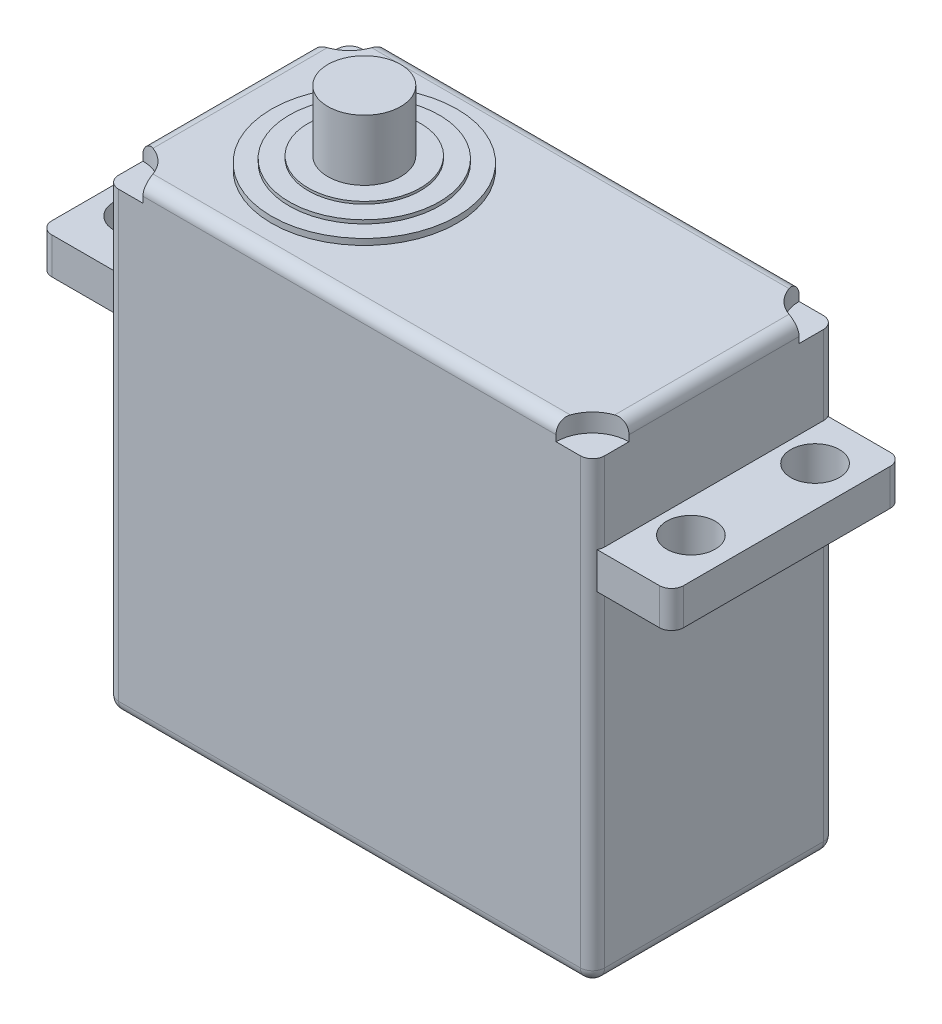
from build123d import *

# Parameters (mm, degrees)
SKETCH_1_W           = 40
SKETCH_1_H           = 39
EXTRUDE_1_DEPTH      = 20
SHELL_1_T            = 2
SKETCH_18_R          = 7.639183899
EXTRUDE_8_DEPTH      = 0.5
SKETCH_24_R          = 6.182414347
EXTRUDE_12_DEPTH     = 0.3
SKETCH_25_R          = 4.612744259
EXTRUDE_13_DEPTH     = 0.2
SKETCH_52_R          = 3
EXTRUDE_14_DEPTH     = 5
SKETCH_55_R          = 3
CUT_EXTRUDE_37_DEPTH = 1.5
SKETCH_78_W          = 19
SKETCH_78_H          = 3
EXTRUDE_16_DEPTH     = 6
SKETCH_79_W          = 19
SKETCH_79_H          = 3
EXTRUDE_17_DEPTH     = 6
FILLET_7_R           = 1
SKETCH_5_R           = 2
CUT_EXTRUDE_45_DEPTH = 50
FILLET_8_R           = 1


with BuildPart() as part:
    # 草图1 → 凸台-拉伸1 (new body)
    with BuildSketch(Plane.XY):
        with Locations((-20, 19.5)):
            Rectangle(SKETCH_1_W, SKETCH_1_H)
    extrude(amount=EXTRUDE_1_DEPTH)

    # 抽壳1 (no face opened: a closed hollow body)
    add(offset(amount=-SHELL_1_T, mode=Mode.PRIVATE), mode=Mode.SUBTRACT)

    # 草图18 → 凸台-拉伸8 (add)
    with BuildSketch(Plane(origin=(0, 39, 0), x_dir=(1, 0, 0), z_dir=(0, 1, 0))):
        with Locations((-28.781890175, -10)):
            Circle(SKETCH_18_R)
    extrude(amount=EXTRUDE_8_DEPTH)

    # 草图24 → 凸台-拉伸12 (add)
    with BuildSketch(Plane(origin=(0, 39.5, 0), x_dir=(1, 0, 0), z_dir=(0, 1, 0))):
        with Locations(Location((-28.781890175, -10, 0), (0, 0, 180))):
            Circle(SKETCH_24_R)
    extrude(amount=EXTRUDE_12_DEPTH)

    # 草图25 → 凸台-拉伸13 (add)
    with BuildSketch(Plane(origin=(0, 39.8, 0), x_dir=(1, 0, 0), z_dir=(0, 1, 0))):
        with Locations(Location((-28.781890175, -10, 0), (0, 0, 180))):
            Circle(SKETCH_25_R)
    extrude(amount=EXTRUDE_13_DEPTH)

    # 草图52 → 凸台-拉伸14 (add)
    with BuildSketch(Plane(origin=(0, 40, 0), x_dir=(1, 0, 0), z_dir=(0, 1, 0))):
        with Locations(Location((-28.781890175, -10, 0), (0, 0, 180))):
            Circle(SKETCH_52_R)
    extrude(amount=EXTRUDE_14_DEPTH)

    # 草图55 → 切除-拉伸37 (cut)
    with BuildSketch(Plane(origin=(0, 39, 0), x_dir=(1, 0, 0), z_dir=(0, 1, 0))):
        with Locations((-40, -20)):
            Circle(SKETCH_55_R)
        with Locations((-40, 0)):
            Circle(SKETCH_55_R)
        with Locations((0, -20)):
            Circle(SKETCH_55_R)
        Circle(SKETCH_55_R)
    extrude(amount=-CUT_EXTRUDE_37_DEPTH, mode=Mode.SUBTRACT)

    # 草图78 → 凸台-拉伸16 (add)
    with BuildSketch(Plane(origin=(0, 0, 0), x_dir=(0, 0, -1), z_dir=(1, 0, 0))):
        with Locations((-10, 29.5)):
            Rectangle(SKETCH_78_W, SKETCH_78_H)
    extrude(amount=EXTRUDE_16_DEPTH)

    # 草图79 → 凸台-拉伸17 (add)
    with BuildSketch(Plane.ZY.offset(40)):
        with Locations((10, 29.5)):
            Rectangle(SKETCH_79_W, SKETCH_79_H)
    extrude(amount=EXTRUDE_17_DEPTH)

    # 圆角7
    # the kernel refuses this fillet: 1 mm, written as the material it takes off along each edge
    with BuildSketch(Plane(origin=(-46, 33.5, 19.5), x_dir=(1, 0, 0), z_dir=(0, -1, 0))) as fillet_7_piece_1:
        with BuildLine():
            CenterArc((FILLET_7_R, -FILLET_7_R), FILLET_7_R, 90, 90)
            Line((0, -FILLET_7_R), (0, 0))
            Line((0, 0), (FILLET_7_R, 0))
        make_face()
    extrude(amount=8, mode=Mode.SUBTRACT)
    with BuildSketch(Plane(origin=(-40, -2.5, 20), x_dir=(1, 0, 0), z_dir=(0, 1, 0))) as fillet_7_piece_2_section:
        with BuildLine():
            CenterArc((FILLET_7_R, FILLET_7_R), FILLET_7_R, 180, 90)
            Line((0, FILLET_7_R), (0, 0))
            Line((0, 0), (FILLET_7_R, 0))
        make_face()
    fillet_7_piece_2 = extrude(amount=42.5, mode=Mode.PRIVATE)
    fillet_7_piece_2 = split(fillet_7_piece_2, bisect_by=Plane(origin=(-39.74487994, 28, 19.835608236), z_dir=(0, -1, 0)), keep=Keep.TOP, mode=Mode.PRIVATE)
    fillet_7_piece_2 = split(fillet_7_piece_2, bisect_by=Plane(origin=(-39.74487994, 12.75, 19.5), z_dir=(0, 0, 1)), keep=Keep.TOP, mode=Mode.PRIVATE)
    add(fillet_7_piece_2, mode=Mode.SUBTRACT)
    with BuildSketch(Plane(origin=(-40, -2.5, 20), x_dir=(1, 0, 0), z_dir=(0, 1, 0))) as fillet_7_piece_3_section:
        with BuildLine():
            CenterArc((FILLET_7_R, FILLET_7_R), FILLET_7_R, 180, 90)
            Line((0, FILLET_7_R), (0, 0))
            Line((0, 0), (FILLET_7_R, 0))
        make_face()
    fillet_7_piece_3 = extrude(amount=42.5, mode=Mode.PRIVATE)
    fillet_7_piece_3 = split(fillet_7_piece_3, bisect_by=Plane(origin=(-39.975991618, 28, 19.336749215), z_dir=(0, -1, 0)), keep=Keep.TOP, mode=Mode.PRIVATE)
    fillet_7_piece_3 = split(fillet_7_piece_3, bisect_by=Plane(origin=(-39.975991618, 12.75, 19.5), z_dir=(0, 0, -1)), keep=Keep.TOP, mode=Mode.PRIVATE)
    add(fillet_7_piece_3, mode=Mode.SUBTRACT)
    with BuildSketch(Plane(origin=(-40, -2.5, 20), x_dir=(1, 0, 0), z_dir=(0, 1, 0))) as fillet_7_piece_4_section:
        with BuildLine():
            CenterArc((FILLET_7_R, FILLET_7_R), FILLET_7_R, 180, 90)
            Line((0, FILLET_7_R), (0, 0))
            Line((0, 0), (FILLET_7_R, 0))
        make_face()
    fillet_7_piece_4 = extrude(amount=42.5, mode=Mode.PRIVATE)
    fillet_7_piece_4 = split(fillet_7_piece_4, bisect_by=Plane(origin=(-39.74487994, 28, 19.835608236), z_dir=(0, 1, 0)), keep=Keep.TOP, mode=Mode.PRIVATE)
    fillet_7_piece_4 = split(fillet_7_piece_4, bisect_by=Plane(origin=(-39.74487994, 29.5, 19.5), z_dir=(0, 0, 1)), keep=Keep.TOP, mode=Mode.PRIVATE)
    fillet_7_piece_4 = split(fillet_7_piece_4, bisect_by=Plane(origin=(-39.74487994, 31, 19.835608236), z_dir=(0, -1, 0)), keep=Keep.TOP, mode=Mode.PRIVATE)
    add(fillet_7_piece_4, mode=Mode.SUBTRACT)
    with BuildSketch(Plane(origin=(-40, -2.5, 20), x_dir=(1, 0, 0), z_dir=(0, 1, 0))) as fillet_7_piece_5_section:
        with BuildLine():
            CenterArc((FILLET_7_R, FILLET_7_R), FILLET_7_R, 180, 90)
            Line((0, FILLET_7_R), (0, 0))
            Line((0, 0), (FILLET_7_R, 0))
        make_face()
    fillet_7_piece_5 = extrude(amount=42.5, mode=Mode.PRIVATE)
    fillet_7_piece_5 = split(fillet_7_piece_5, bisect_by=Plane(origin=(-39.74487994, 35.5, 19.5), z_dir=(0, 0, 1)), keep=Keep.TOP, mode=Mode.PRIVATE)
    fillet_7_piece_5 = split(fillet_7_piece_5, bisect_by=Plane(origin=(-39.74487994, 31, 19.835608236), z_dir=(0, 1, 0)), keep=Keep.TOP, mode=Mode.PRIVATE)
    add(fillet_7_piece_5, mode=Mode.SUBTRACT)
    with BuildSketch(Plane(origin=(-40, -2.5, 20), x_dir=(1, 0, 0), z_dir=(0, 1, 0))) as fillet_7_piece_6_section:
        with BuildLine():
            CenterArc((FILLET_7_R, FILLET_7_R), FILLET_7_R, 180, 90)
            Line((0, FILLET_7_R), (0, 0))
            Line((0, 0), (FILLET_7_R, 0))
        make_face()
    fillet_7_piece_6 = extrude(amount=42.5, mode=Mode.PRIVATE)
    fillet_7_piece_6 = split(fillet_7_piece_6, bisect_by=Plane(origin=(-39.975991618, 35.5, 19.5), z_dir=(0, 0, -1)), keep=Keep.TOP, mode=Mode.PRIVATE)
    fillet_7_piece_6 = split(fillet_7_piece_6, bisect_by=Plane(origin=(-39.975991618, 31, 19.336749215), z_dir=(0, 1, 0)), keep=Keep.TOP, mode=Mode.PRIVATE)
    add(fillet_7_piece_6, mode=Mode.SUBTRACT)

    # 草图5 → 切除-拉伸45 (cut)
    with BuildSketch(Plane(origin=(0, 0, 0), x_dir=(1, 0, 0), z_dir=(0, 1, 0))):
        with Locations(Location((-42.781890175, -14.609647665, 0), (0, 0, 90))):
            Circle(SKETCH_5_R)
        with Locations(Location((-42.853081645, -4.609647665, 0), (0, 0, 90))):
            Circle(SKETCH_5_R)
        with Locations((2.709458981, -4.393671759)):
            Circle(SKETCH_5_R)
        with Locations((2.709458981, -14.609647665)):
            Circle(SKETCH_5_R)
    extrude(amount=CUT_EXTRUDE_45_DEPTH, mode=Mode.SUBTRACT)

    # 圆角8
    # the kernel refuses this fillet: 1 mm, written as the material it takes off along each edge
    with BuildSketch(Plane(origin=(-1, 1, 19), x_dir=(1, 0, 0), z_dir=(0, -1, 0))) as fillet_8_piece_1_section:
        Polygon((0, 0), (FILLET_8_R, 0), (FILLET_8_R, FILLET_8_R), (0, FILLET_8_R), align=None)
    fillet_8_piece_1 = extrude(amount=FILLET_8_R, mode=Mode.PRIVATE)
    fillet_8_piece_1 = fillet_8_piece_1 - Plane(origin=(-1, 1, 19), x_dir=(-0.7071067811865475, 0, -0.7071067811865475), z_dir=(0, -1, 0)) * Sphere(FILLET_8_R, mode=Mode.PRIVATE)
    add(fillet_8_piece_1, mode=Mode.SUBTRACT)
    with BuildSketch(Plane(origin=(-39, 1, 1), x_dir=(0, 0, -1), z_dir=(-1, 0, 0))) as fillet_8_piece_2_section:
        Polygon((0, 0), (FILLET_8_R, 0), (FILLET_8_R, FILLET_8_R), (0, FILLET_8_R), align=None)
    fillet_8_piece_2 = extrude(amount=FILLET_8_R, mode=Mode.PRIVATE)
    fillet_8_piece_2 = fillet_8_piece_2 - Plane(origin=(-39, 1, 1), x_dir=(0, 0.7071067811865475, 0.7071067811865475), z_dir=(-1, 0, 0)) * Sphere(FILLET_8_R, mode=Mode.PRIVATE)
    add(fillet_8_piece_2, mode=Mode.SUBTRACT)
    with BuildSketch(Plane(origin=(-1, 1, 1), x_dir=(0, -1, 0), z_dir=(0, 0, -1))) as fillet_8_piece_3_section:
        Polygon((0, 0), (FILLET_8_R, 0), (FILLET_8_R, -FILLET_8_R), (0, -FILLET_8_R), align=None)
    fillet_8_piece_3 = extrude(amount=FILLET_8_R, mode=Mode.PRIVATE)
    fillet_8_piece_3 = fillet_8_piece_3 - Plane(origin=(-1, 1, 1), x_dir=(-0.7071067811865475, 0.7071067811865475, 0), z_dir=(0, 0, -1)) * Sphere(FILLET_8_R, mode=Mode.PRIVATE)
    add(fillet_8_piece_3, mode=Mode.SUBTRACT)
    with BuildSketch(Plane(origin=(-1, 0, 20), x_dir=(0, 1, 0), z_dir=(-1, 0, 0))) as fillet_8_piece_4:
        with BuildLine():
            CenterArc((FILLET_8_R, FILLET_8_R), FILLET_8_R, 180, 90)
            Line((0, FILLET_8_R), (0, 0))
            Line((0, 0), (FILLET_8_R, 0))
        make_face()
    extrude(amount=38, mode=Mode.SUBTRACT)
    with BuildSketch(Plane(origin=(-39, 0, 19), x_dir=(0, 0, 1), z_dir=(1, 0, 0))) as fillet_8_piece_5:
        with BuildLine():
            CenterArc((1 - FILLET_8_R, -FILLET_8_R), FILLET_8_R, 0, 90)
            Line((1, -FILLET_8_R), (1, 0))
            Line((1, 0), (1 - FILLET_8_R, 0))
        make_face()
    revolve(axis=Axis((-39, 0, 19), (0, -1, 0)), revolution_arc=90, mode=Mode.SUBTRACT)
    with BuildSketch(Plane(origin=(-40, 0, 1), x_dir=(0, 1, 0), z_dir=(0, 0, 1))) as fillet_8_piece_6:
        with BuildLine():
            CenterArc((FILLET_8_R, -FILLET_8_R), FILLET_8_R, 90, 90)
            Line((0, -FILLET_8_R), (0, 0))
            Line((0, 0), (FILLET_8_R, 0))
        make_face()
    extrude(amount=18, mode=Mode.SUBTRACT)
    with BuildSketch(Plane(origin=(0, 0, 1), x_dir=(0, 1, 0), z_dir=(0, 0, 1))) as fillet_8_piece_7:
        with BuildLine():
            CenterArc((FILLET_8_R, FILLET_8_R), FILLET_8_R, 180, 90)
            Line((0, FILLET_8_R), (0, 0))
            Line((0, 0), (FILLET_8_R, 0))
        make_face()
    extrude(amount=18, mode=Mode.SUBTRACT)
    with BuildSketch(Plane(origin=(-1, 0, 0), x_dir=(0, 1, 0), z_dir=(-1, 0, 0))) as fillet_8_piece_8:
        with BuildLine():
            CenterArc((FILLET_8_R, -FILLET_8_R), FILLET_8_R, 90, 90)
            Line((0, -FILLET_8_R), (0, 0))
            Line((0, 0), (FILLET_8_R, 0))
        make_face()
    extrude(amount=38, mode=Mode.SUBTRACT)
    with BuildSketch(Plane(origin=(0, 40, 0), x_dir=(-1, 0, 0), z_dir=(0, -1, 0))) as fillet_8_piece_9_section:
        with BuildLine():
            CenterArc((FILLET_8_R, -FILLET_8_R), FILLET_8_R, 90, 90)
            Line((0, -FILLET_8_R), (0, 0))
            Line((0, 0), (FILLET_8_R, 0))
        make_face()
    fillet_8_piece_9 = extrude(amount=39, mode=Mode.PRIVATE)
    fillet_8_piece_9 = split(fillet_8_piece_9, bisect_by=Plane(origin=(-0.25512006, 35.5, 0.5), z_dir=(0, 0, -1)), keep=Keep.TOP, mode=Mode.PRIVATE)
    fillet_8_piece_9 = split(fillet_8_piece_9, bisect_by=Plane(origin=(-0.25512006, 31, 0.164391764), z_dir=(0, 1, 0)), keep=Keep.TOP, mode=Mode.PRIVATE)
    add(fillet_8_piece_9, mode=Mode.SUBTRACT)
    with BuildSketch(Plane(origin=(0, 40, 0), x_dir=(-1, 0, 0), z_dir=(0, -1, 0))) as fillet_8_piece_10_section:
        with BuildLine():
            CenterArc((FILLET_8_R, -FILLET_8_R), FILLET_8_R, 90, 90)
            Line((0, -FILLET_8_R), (0, 0))
            Line((0, 0), (FILLET_8_R, 0))
        make_face()
    fillet_8_piece_10 = extrude(amount=39, mode=Mode.PRIVATE)
    fillet_8_piece_10 = split(fillet_8_piece_10, bisect_by=Plane(origin=(-0.024008382, 35.5, 0.5), z_dir=(0, 0, 1)), keep=Keep.TOP, mode=Mode.PRIVATE)
    fillet_8_piece_10 = split(fillet_8_piece_10, bisect_by=Plane(origin=(-0.024008382, 31, 0.663250785), z_dir=(0, 1, 0)), keep=Keep.TOP, mode=Mode.PRIVATE)
    add(fillet_8_piece_10, mode=Mode.SUBTRACT)
    with BuildSketch(Plane(origin=(0, 40, 0), x_dir=(-1, 0, 0), z_dir=(0, -1, 0))) as fillet_8_piece_11_section:
        with BuildLine():
            CenterArc((FILLET_8_R, -FILLET_8_R), FILLET_8_R, 90, 90)
            Line((0, -FILLET_8_R), (0, 0))
            Line((0, 0), (FILLET_8_R, 0))
        make_face()
    fillet_8_piece_11 = extrude(amount=39, mode=Mode.PRIVATE)
    fillet_8_piece_11 = split(fillet_8_piece_11, bisect_by=Plane(origin=(-0.25512006, 28, 0.164391764), z_dir=(0, 1, 0)), keep=Keep.TOP, mode=Mode.PRIVATE)
    fillet_8_piece_11 = split(fillet_8_piece_11, bisect_by=Plane(origin=(-0.25512006, 29.5, 0.5), z_dir=(0, 0, -1)), keep=Keep.TOP, mode=Mode.PRIVATE)
    fillet_8_piece_11 = split(fillet_8_piece_11, bisect_by=Plane(origin=(-0.25512006, 31, 0.164391764), z_dir=(0, -1, 0)), keep=Keep.TOP, mode=Mode.PRIVATE)
    add(fillet_8_piece_11, mode=Mode.SUBTRACT)
    with BuildSketch(Plane(origin=(0, 40, 0), x_dir=(-1, 0, 0), z_dir=(0, -1, 0))) as fillet_8_piece_12_section:
        with BuildLine():
            CenterArc((FILLET_8_R, -FILLET_8_R), FILLET_8_R, 90, 90)
            Line((0, -FILLET_8_R), (0, 0))
            Line((0, 0), (FILLET_8_R, 0))
        make_face()
    fillet_8_piece_12 = extrude(amount=39, mode=Mode.PRIVATE)
    fillet_8_piece_12 = split(fillet_8_piece_12, bisect_by=Plane(origin=(-0.25512006, 28, 0.164391764), z_dir=(0, -1, 0)), keep=Keep.TOP, mode=Mode.PRIVATE)
    fillet_8_piece_12 = split(fillet_8_piece_12, bisect_by=Plane(origin=(-0.25512006, 14.5, 0.5), z_dir=(0, 0, -1)), keep=Keep.TOP, mode=Mode.PRIVATE)
    add(fillet_8_piece_12, mode=Mode.SUBTRACT)
    with BuildSketch(Plane(origin=(0, 40, 0), x_dir=(-1, 0, 0), z_dir=(0, -1, 0))) as fillet_8_piece_13_section:
        with BuildLine():
            CenterArc((FILLET_8_R, -FILLET_8_R), FILLET_8_R, 90, 90)
            Line((0, -FILLET_8_R), (0, 0))
            Line((0, 0), (FILLET_8_R, 0))
        make_face()
    fillet_8_piece_13 = extrude(amount=39, mode=Mode.PRIVATE)
    fillet_8_piece_13 = split(fillet_8_piece_13, bisect_by=Plane(origin=(-0.024008382, 28, 0.663250785), z_dir=(0, -1, 0)), keep=Keep.TOP, mode=Mode.PRIVATE)
    fillet_8_piece_13 = split(fillet_8_piece_13, bisect_by=Plane(origin=(-0.024008382, 14.5, 0.5), z_dir=(0, 0, 1)), keep=Keep.TOP, mode=Mode.PRIVATE)
    add(fillet_8_piece_13, mode=Mode.SUBTRACT)
    with BuildSketch(Plane(origin=(-40, 1, 0), x_dir=(1, 0, 0), z_dir=(0, 1, 0))) as fillet_8_piece_14_section:
        with BuildLine():
            CenterArc((FILLET_8_R, -FILLET_8_R), FILLET_8_R, 90, 90)
            Line((0, -FILLET_8_R), (0, 0))
            Line((0, 0), (FILLET_8_R, 0))
        make_face()
    fillet_8_piece_14 = extrude(amount=39, mode=Mode.PRIVATE)
    fillet_8_piece_14 = split(fillet_8_piece_14, bisect_by=Plane(origin=(-39.74487994, 14.5, 0.5), z_dir=(0, 0, -1)), keep=Keep.TOP, mode=Mode.PRIVATE)
    fillet_8_piece_14 = split(fillet_8_piece_14, bisect_by=Plane(origin=(-39.74487994, 28, 0.164391764), z_dir=(0, -1, 0)), keep=Keep.TOP, mode=Mode.PRIVATE)
    add(fillet_8_piece_14, mode=Mode.SUBTRACT)
    with BuildSketch(Plane(origin=(-40, 1, 0), x_dir=(1, 0, 0), z_dir=(0, 1, 0))) as fillet_8_piece_15_section:
        with BuildLine():
            CenterArc((FILLET_8_R, -FILLET_8_R), FILLET_8_R, 90, 90)
            Line((0, -FILLET_8_R), (0, 0))
            Line((0, 0), (FILLET_8_R, 0))
        make_face()
    fillet_8_piece_15 = extrude(amount=39, mode=Mode.PRIVATE)
    fillet_8_piece_15 = split(fillet_8_piece_15, bisect_by=Plane(origin=(-39.975991618, 14.5, 0.5), z_dir=(0, 0, 1)), keep=Keep.TOP, mode=Mode.PRIVATE)
    fillet_8_piece_15 = split(fillet_8_piece_15, bisect_by=Plane(origin=(-39.975991618, 28, 0.663250785), z_dir=(0, -1, 0)), keep=Keep.TOP, mode=Mode.PRIVATE)
    add(fillet_8_piece_15, mode=Mode.SUBTRACT)
    with BuildSketch(Plane(origin=(-40, 1, 0), x_dir=(1, 0, 0), z_dir=(0, 1, 0))) as fillet_8_piece_16_section:
        with BuildLine():
            CenterArc((FILLET_8_R, -FILLET_8_R), FILLET_8_R, 90, 90)
            Line((0, -FILLET_8_R), (0, 0))
            Line((0, 0), (FILLET_8_R, 0))
        make_face()
    fillet_8_piece_16 = extrude(amount=39, mode=Mode.PRIVATE)
    fillet_8_piece_16 = split(fillet_8_piece_16, bisect_by=Plane(origin=(-39.74487994, 31, 0.164391764), z_dir=(0, -1, 0)), keep=Keep.TOP, mode=Mode.PRIVATE)
    fillet_8_piece_16 = split(fillet_8_piece_16, bisect_by=Plane(origin=(-39.74487994, 29.5, 0.5), z_dir=(0, 0, -1)), keep=Keep.TOP, mode=Mode.PRIVATE)
    fillet_8_piece_16 = split(fillet_8_piece_16, bisect_by=Plane(origin=(-39.74487994, 28, 0.164391764), z_dir=(0, 1, 0)), keep=Keep.TOP, mode=Mode.PRIVATE)
    add(fillet_8_piece_16, mode=Mode.SUBTRACT)
    with BuildSketch(Plane(origin=(-40, 1, 0), x_dir=(1, 0, 0), z_dir=(0, 1, 0))) as fillet_8_piece_17_section:
        with BuildLine():
            CenterArc((FILLET_8_R, -FILLET_8_R), FILLET_8_R, 90, 90)
            Line((0, -FILLET_8_R), (0, 0))
            Line((0, 0), (FILLET_8_R, 0))
        make_face()
    fillet_8_piece_17 = extrude(amount=39, mode=Mode.PRIVATE)
    fillet_8_piece_17 = split(fillet_8_piece_17, bisect_by=Plane(origin=(-39.74487994, 31, 0.164391764), z_dir=(0, 1, 0)), keep=Keep.TOP, mode=Mode.PRIVATE)
    fillet_8_piece_17 = split(fillet_8_piece_17, bisect_by=Plane(origin=(-39.74487994, 35.5, 0.5), z_dir=(0, 0, -1)), keep=Keep.TOP, mode=Mode.PRIVATE)
    add(fillet_8_piece_17, mode=Mode.SUBTRACT)
    with BuildSketch(Plane(origin=(-40, 1, 0), x_dir=(1, 0, 0), z_dir=(0, 1, 0))) as fillet_8_piece_18_section:
        with BuildLine():
            CenterArc((FILLET_8_R, -FILLET_8_R), FILLET_8_R, 90, 90)
            Line((0, -FILLET_8_R), (0, 0))
            Line((0, 0), (FILLET_8_R, 0))
        make_face()
    fillet_8_piece_18 = extrude(amount=39, mode=Mode.PRIVATE)
    fillet_8_piece_18 = split(fillet_8_piece_18, bisect_by=Plane(origin=(-39.975991618, 31, 0.663250785), z_dir=(0, 1, 0)), keep=Keep.TOP, mode=Mode.PRIVATE)
    fillet_8_piece_18 = split(fillet_8_piece_18, bisect_by=Plane(origin=(-39.975991618, 35.5, 0.5), z_dir=(0, 0, 1)), keep=Keep.TOP, mode=Mode.PRIVATE)
    add(fillet_8_piece_18, mode=Mode.SUBTRACT)
    with BuildSketch(Plane(origin=(-46, 25.5, 0.5), x_dir=(1, 0, 0), z_dir=(0, 1, 0)), Plane(origin=(6, 25.5, 19.5), x_dir=(-1, 0, 0), z_dir=(0, 1, 0)), Plane(origin=(6, 33.5, 0.5), x_dir=(-1, 0, 0), z_dir=(0, -1, 0))) as fillet_8_piece_19:
        with BuildLine():
            CenterArc((FILLET_8_R, -FILLET_8_R), FILLET_8_R, 90, 90)
            Line((0, -FILLET_8_R), (0, 0))
            Line((0, 0), (FILLET_8_R, 0))
        make_face()
    extrude(amount=8, mode=Mode.SUBTRACT)
    with BuildSketch(Plane(origin=(-39.5, 39, 0), x_dir=(0, 0, 1), z_dir=(1, 0, 0))) as fillet_8_piece_20:
        with BuildLine():
            CenterArc((FILLET_8_R, FILLET_8_R), FILLET_8_R, 180, 90)
            Line((0, FILLET_8_R), (0, 0))
            Line((0, 0), (FILLET_8_R, 0))
        make_face()
    extrude(amount=39, mode=Mode.SUBTRACT)
    with BuildSketch(Plane(origin=(0, 39, 0.5), x_dir=(-1, 0, 0), z_dir=(0, 0, 1))) as fillet_8_piece_21:
        with BuildLine():
            CenterArc((FILLET_8_R, FILLET_8_R), FILLET_8_R, 180, 90)
            Line((0, FILLET_8_R), (0, 0))
            Line((0, 0), (FILLET_8_R, 0))
        make_face()
    extrude(amount=19, mode=Mode.SUBTRACT)
    with BuildSketch(Plane(origin=(0, 40, 20), x_dir=(0, 0, -1), z_dir=(0, -1, 0))) as fillet_8_piece_22_section:
        with BuildLine():
            CenterArc((FILLET_8_R, -FILLET_8_R), FILLET_8_R, 90, 90)
            Line((0, -FILLET_8_R), (0, 0))
            Line((0, 0), (FILLET_8_R, 0))
        make_face()
    fillet_8_piece_22 = extrude(amount=39, mode=Mode.PRIVATE)
    fillet_8_piece_22 = split(fillet_8_piece_22, bisect_by=Plane(origin=(-0.024008382, 35.5, 19.5), z_dir=(0, 0, -1)), keep=Keep.TOP, mode=Mode.PRIVATE)
    fillet_8_piece_22 = split(fillet_8_piece_22, bisect_by=Plane(origin=(-0.024008382, 31, 19.336749215), z_dir=(0, 1, 0)), keep=Keep.TOP, mode=Mode.PRIVATE)
    add(fillet_8_piece_22, mode=Mode.SUBTRACT)
    with BuildSketch(Plane(origin=(0, 40, 20), x_dir=(0, 0, -1), z_dir=(0, -1, 0))) as fillet_8_piece_23_section:
        with BuildLine():
            CenterArc((FILLET_8_R, -FILLET_8_R), FILLET_8_R, 90, 90)
            Line((0, -FILLET_8_R), (0, 0))
            Line((0, 0), (FILLET_8_R, 0))
        make_face()
    fillet_8_piece_23 = extrude(amount=39, mode=Mode.PRIVATE)
    fillet_8_piece_23 = split(fillet_8_piece_23, bisect_by=Plane(origin=(-0.25512006, 35.5, 19.5), z_dir=(0, 0, 1)), keep=Keep.TOP, mode=Mode.PRIVATE)
    fillet_8_piece_23 = split(fillet_8_piece_23, bisect_by=Plane(origin=(-0.25512006, 31, 19.835608236), z_dir=(0, 1, 0)), keep=Keep.TOP, mode=Mode.PRIVATE)
    add(fillet_8_piece_23, mode=Mode.SUBTRACT)
    with BuildSketch(Plane(origin=(0, 40, 20), x_dir=(0, 0, -1), z_dir=(0, -1, 0))) as fillet_8_piece_24_section:
        with BuildLine():
            CenterArc((FILLET_8_R, -FILLET_8_R), FILLET_8_R, 90, 90)
            Line((0, -FILLET_8_R), (0, 0))
            Line((0, 0), (FILLET_8_R, 0))
        make_face()
    fillet_8_piece_24 = extrude(amount=39, mode=Mode.PRIVATE)
    fillet_8_piece_24 = split(fillet_8_piece_24, bisect_by=Plane(origin=(-0.25512006, 29.5, 19.5), z_dir=(0, 0, 1)), keep=Keep.TOP, mode=Mode.PRIVATE)
    fillet_8_piece_24 = split(fillet_8_piece_24, bisect_by=Plane(origin=(-0.25512006, 28, 19.835608236), z_dir=(0, 1, 0)), keep=Keep.TOP, mode=Mode.PRIVATE)
    fillet_8_piece_24 = split(fillet_8_piece_24, bisect_by=Plane(origin=(-0.25512006, 31, 19.835608236), z_dir=(0, -1, 0)), keep=Keep.TOP, mode=Mode.PRIVATE)
    add(fillet_8_piece_24, mode=Mode.SUBTRACT)
    with BuildSketch(Plane(origin=(0, 40, 20), x_dir=(0, 0, -1), z_dir=(0, -1, 0))) as fillet_8_piece_25_section:
        with BuildLine():
            CenterArc((FILLET_8_R, -FILLET_8_R), FILLET_8_R, 90, 90)
            Line((0, -FILLET_8_R), (0, 0))
            Line((0, 0), (FILLET_8_R, 0))
        make_face()
    fillet_8_piece_25 = extrude(amount=39, mode=Mode.PRIVATE)
    fillet_8_piece_25 = split(fillet_8_piece_25, bisect_by=Plane(origin=(-0.024008382, 14.5, 19.5), z_dir=(0, 0, -1)), keep=Keep.TOP, mode=Mode.PRIVATE)
    fillet_8_piece_25 = split(fillet_8_piece_25, bisect_by=Plane(origin=(-0.024008382, 28, 19.336749215), z_dir=(0, -1, 0)), keep=Keep.TOP, mode=Mode.PRIVATE)
    add(fillet_8_piece_25, mode=Mode.SUBTRACT)
    with BuildSketch(Plane(origin=(0, 40, 20), x_dir=(0, 0, -1), z_dir=(0, -1, 0))) as fillet_8_piece_26_section:
        with BuildLine():
            CenterArc((FILLET_8_R, -FILLET_8_R), FILLET_8_R, 90, 90)
            Line((0, -FILLET_8_R), (0, 0))
            Line((0, 0), (FILLET_8_R, 0))
        make_face()
    fillet_8_piece_26 = extrude(amount=39, mode=Mode.PRIVATE)
    fillet_8_piece_26 = split(fillet_8_piece_26, bisect_by=Plane(origin=(-0.25512006, 14.5, 19.5), z_dir=(0, 0, 1)), keep=Keep.TOP, mode=Mode.PRIVATE)
    fillet_8_piece_26 = split(fillet_8_piece_26, bisect_by=Plane(origin=(-0.25512006, 28, 19.835608236), z_dir=(0, -1, 0)), keep=Keep.TOP, mode=Mode.PRIVATE)
    add(fillet_8_piece_26, mode=Mode.SUBTRACT)
    with BuildSketch(Plane(origin=(-40, 39, 0.5), x_dir=(1, 0, 0), z_dir=(0, 0, 1))) as fillet_8_piece_27:
        with BuildLine():
            CenterArc((FILLET_8_R, -FILLET_8_R), FILLET_8_R, 90, 90)
            Line((0, -FILLET_8_R), (0, 0))
            Line((0, 0), (FILLET_8_R, 0))
        make_face()
    extrude(amount=19, mode=Mode.SUBTRACT)
    with BuildSketch(Plane(origin=(-39.5, 39, 20), x_dir=(0, 0, -1), z_dir=(1, 0, 0))) as fillet_8_piece_28:
        with BuildLine():
            CenterArc((FILLET_8_R, -FILLET_8_R), FILLET_8_R, 90, 90)
            Line((0, -FILLET_8_R), (0, 0))
            Line((0, 0), (FILLET_8_R, 0))
        make_face()
    extrude(amount=39, mode=Mode.SUBTRACT)


solid = part.part
